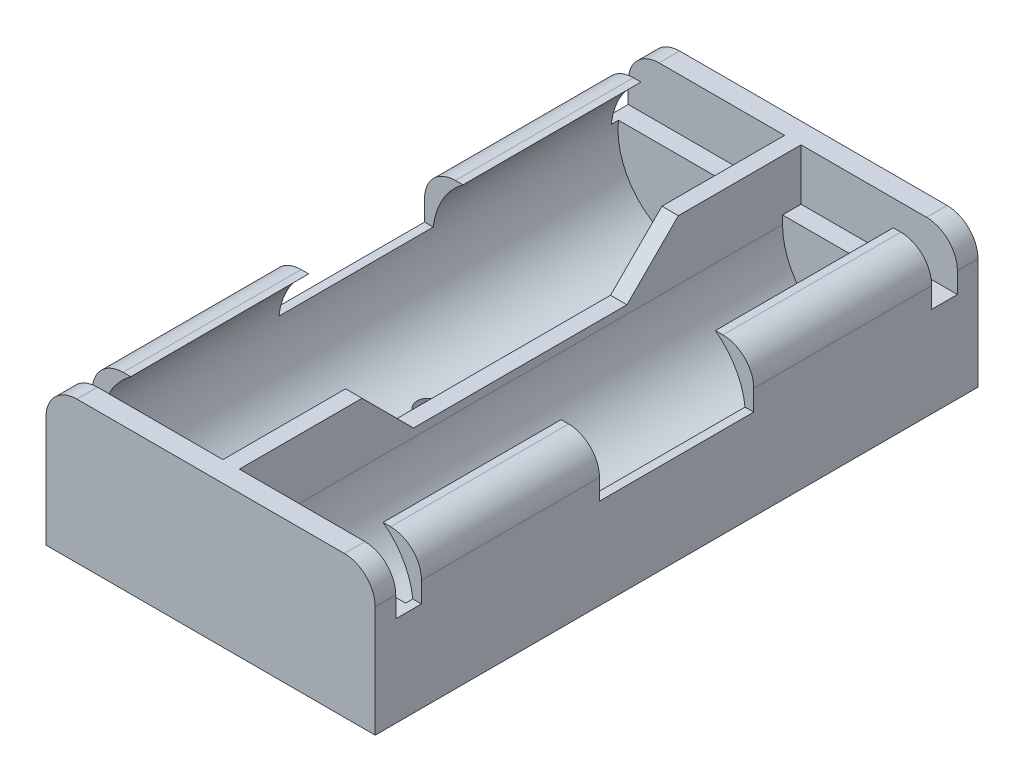
from build123d import *

# Parameters (mm, degrees)
SKETCH1_W               = 40.64
SKETCH1_H               = 17.526
BOSS_EXTRUDE1_DEPTH     = 37.211
CUT_EXTRUDE1_DEPTH      = 32.385
FILLET1_R               = 3.81
SKETCH3_W               = 3.175
SKETCH3_H               = 6.35
SKETCH3_W_2             = 19.05
CUT_EXTRUDE2_DEPTH      = 58.822390101
CHAMFER1_SIZE           = 10
CUT_EXTRUDE7_DEPTH      = 58.822390101
CUT_EXTRUDE7_DEPTH_BACK = 58.822390101
SKETCH5_R               = 1.5875
BOSS_EXTRUDE2_REACH     = 83.728
SKETCH6_W               = 2.032
SKETCH6_H               = 6.35
BOSS_EXTRUDE3_REACH     = 83.728
SKETCH7_W               = 2.032
SKETCH7_H               = 6.35


with BuildPart() as part:
    # Sketch1 → Boss-Extrude1 (new, symmetric)
    with BuildSketch(Plane.XY):
        with Locations((20.32, 8.763)):
            Rectangle(SKETCH1_W, SKETCH1_H)
    extrude(amount=BOSS_EXTRUDE1_DEPTH, both=True)

    # Sketch2 → Cut-Extrude1 (cut, symmetric)
    with BuildSketch(Plane.XY):
        with BuildLine():
            Line((19.304, 10.16), (19.304, 17.526))
            Line((19.304, 17.526), (15.578005168, 17.526))
            ThreePointArc((15.578005168, 17.526), (2.000497097, 6.032622095), (19.304, 10.16))
        make_face()
        with BuildLine():
            Line((21.336, 10.16), (21.336, 17.526))
            Line((21.336, 17.526), (25.061994832, 17.526))
            ThreePointArc((25.061994832, 17.526), (38.639502903, 6.032622095), (21.336, 10.16))
        make_face()
    extrude(amount=CUT_EXTRUDE1_DEPTH, both=True, mode=Mode.SUBTRACT)

    # Fillet1
    fillet1_edges = [part.edges().sort_by_distance(p)[0] for p in [
        (0, 17.526, 0),
        (40.64, 17.526, 0),
    ]]
    fillet(fillet1_edges, radius=FILLET1_R)

    # Sketch3 → Cut-Extrude2 (cut, through all)
    with BuildSketch(Plane(origin=(40.64, 0, 0), x_dir=(0, 0, -1), z_dir=(1, 0, 0))):
        with Locations((-33.0835, 14.351)):
            Rectangle(SKETCH3_W, SKETCH3_H)
        with Locations((0, 14.351)):
            Rectangle(SKETCH3_W_2, SKETCH3_H)
        with Locations((33.0835, 14.351)):
            Rectangle(SKETCH3_W, SKETCH3_H)
    extrude(amount=-CUT_EXTRUDE2_DEPTH, mode=Mode.SUBTRACT)

    # Chamfer1
    # the kernel refuses this chamfer: 10 mm, written as the material it takes off along each edge
    with BuildSketch(Plane(origin=(21.336, 17.526, -9.525), x_dir=(0, -0.9996219169112968, 0.027495876610586664), z_dir=(-1, 0, 0))) as chamfer1_piece_1_section:
        Polygon((CHAMFER1_SIZE * 0.999621916911, -CHAMFER1_SIZE * 0.0274958766106), (-CHAMFER1_SIZE * 0.0274958766106, -CHAMFER1_SIZE * 0.999621916911), (0, 0), align=None)
    chamfer1_piece_1 = extrude(amount=2.032, mode=Mode.PRIVATE)
    chamfer1_piece_1 = split(chamfer1_piece_1, bisect_by=Plane(origin=(20.32, 11.176, -13.183669109), z_dir=(0, 1, 0)), keep=Keep.TOP, mode=Mode.PRIVATE)
    add(chamfer1_piece_1, mode=Mode.SUBTRACT)
    with BuildSketch(Plane(origin=(21.336, 17.526, 9.525), x_dir=(0, 0.027495876610586324, 0.9996219169112968), z_dir=(-1, 0, 0))) as chamfer1_piece_2_section:
        Polygon((CHAMFER1_SIZE * 0.999621916911, -CHAMFER1_SIZE * 0.0274958766106), (-CHAMFER1_SIZE * 0.0274958766106, -CHAMFER1_SIZE * 0.999621916911), (0, 0), align=None)
    chamfer1_piece_2 = extrude(amount=2.032, mode=Mode.PRIVATE)
    chamfer1_piece_2 = split(chamfer1_piece_2, bisect_by=Plane(origin=(20.32, 11.176, 13.183669109), z_dir=(0, 1, 0)), keep=Keep.TOP, mode=Mode.PRIVATE)
    add(chamfer1_piece_2, mode=Mode.SUBTRACT)

    # Sketch5 → Cut-Extrude7 (cut, two sides: drawn at the far end of the back side and taken through both)
    with BuildSketch(Plane.XZ.offset(-CUT_EXTRUDE7_DEPTH_BACK)):
        with Locations(Location((30.423380261, 0, 0), (0, 0, 270))):
            Circle(SKETCH5_R)
        with Locations(Location((10.216619739, 0, 0), (0, 0, 270))):
            Circle(SKETCH5_R)
    extrude(amount=CUT_EXTRUDE7_DEPTH + CUT_EXTRUDE7_DEPTH_BACK, mode=Mode.SUBTRACT)

    # Sketch6 → Boss-Extrude2 (add, up to next)
    with BuildSketch(Plane(origin=(0, 0, -31.496), x_dir=(-1, 0, 0), z_dir=(0, 0, -1)), mode=Mode.PRIVATE) as boss_extrude2_sk1:
        with Locations((-20.32, 14.351)):
            Rectangle(SKETCH6_W, SKETCH6_H)
    boss_extrude2_tool1 = extrude(boss_extrude2_sk1.sketch, amount=BOSS_EXTRUDE2_REACH, mode=Mode.PRIVATE) - part.part
    add(boss_extrude2_tool1.solids().sort_by_distance((20.32, 14.351, -31.496))[0])

    # Sketch7 → Boss-Extrude3 (add, up to next)
    with BuildSketch(Plane.XY.offset(31.496), mode=Mode.PRIVATE) as boss_extrude3_sk1:
        with Locations((20.32, 14.351)):
            Rectangle(SKETCH7_W, SKETCH7_H)
    boss_extrude3_tool1 = extrude(boss_extrude3_sk1.sketch, amount=BOSS_EXTRUDE3_REACH, mode=Mode.PRIVATE) - part.part
    add(boss_extrude3_tool1.solids().sort_by_distance((20.32, 14.351, 31.496))[0])


solid = part.part
